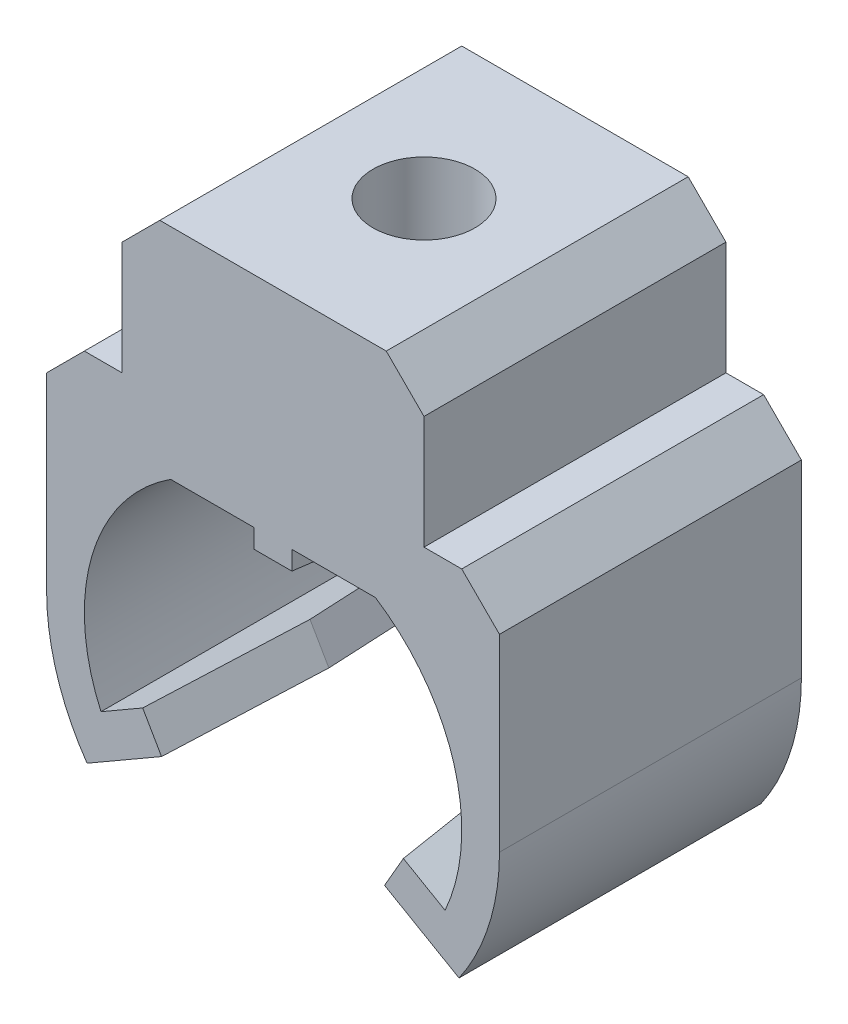
from build123d import *
from OCP.BRepFilletAPI import BRepFilletAPI_MakeChamfer

# Parameters (mm, degrees)
BOSS_EXTRUDE2_DEPTH = 8
SKETCH11_R          = 1.35
CUT_EXTRUDE5_DEPTH  = 5
CHAMFER1_SIZE       = 1
CHAMFER2_SIZE       = 4
CHAMFER2_SIZE_2     = 0.5
CHAMFER3_SIZE       = 0.5
CHAMFER3_SIZE2      = 4


with BuildPart() as part:
    # Sketch1 → Boss-Extrude2 (new body)
    with BuildSketch(Plane.XY):
        with BuildLine():
            Line((-2.712931993, 4.2), (-0.5, 4.2))
            Line((-0.5, 4.2), (-0.5, 3.2))
            Line((-0.5, 3.2), (0.5, 3.2))
            Line((0.5, 3.2), (0.5, 4.2))
            Line((0.5, 4.2), (2.712931993, 4.2))
            ThreePointArc((2.712931993, 4.2), (4.795591913, 1.415025868), (4.558421985, -2.054455891))
            Line((4.558421985, -2.054455891), (3.021281292, -1.166987298))
            Line((3.021281292, -1.166987298), (2.521281292, -2.033012702))
            Line((2.521281292, -2.033012702), (4.928078794, -3.422577888))
            ThreePointArc((4.928078794, -3.422577888), (5.725752036, -1.793255034), (6, 0))
            Line((6, 0), (6, 6))
            Line((6, 6), (4, 6))
            Line((4, 6), (4, 10))
            Line((4, 10), (-4, 10))
            Line((-4, 10), (-4, 6))
            Line((-4, 6), (-6, 6))
            Line((-6, 6), (-6, 0))
            ThreePointArc((-6, 0), (-5.725752036, -1.793255034), (-4.928078794, -3.422577888))
            Line((-4.928078794, -3.422577888), (-2.521281292, -2.033012702))
            Line((-2.521281292, -2.033012702), (-3.021281292, -1.166987298))
            Line((-3.021281292, -1.166987298), (-4.558421985, -2.054455891))
            ThreePointArc((-4.558421985, -2.054455891), (-4.795591913, 1.415025868), (-2.712931993, 4.2))
        make_face()
    extrude(amount=BOSS_EXTRUDE2_DEPTH)

    # Sketch11 → Cut-Extrude5 (cut)
    with BuildSketch(Plane(origin=(0, 10, 0), x_dir=(1, 0, 0), z_dir=(0, 1, 0))):
        with Locations(Location((0, -4, 0), (0, 0, 270))):
            Circle(SKETCH11_R)
    extrude(amount=-CUT_EXTRUDE5_DEPTH, mode=Mode.SUBTRACT)

    # Chamfer1
    chamfer1_edges = [part.edges().sort_by_distance(p)[0] for p in [
        (-6, 6, 4),
        (-4, 10, 4),
        (4, 10, 4),
        (6, 6, 4),
    ]]
    chamfer(chamfer1_edges, length=CHAMFER1_SIZE)

    # Chamfer2
    chamfer2_edges_1 = [part.edges().sort_by_distance(p)[0] for p in [
        (2.771281292, -1.6, 8),
    ]]
    chamfer2_side_1 = [part.faces().sort_by_distance(p)[0] for p in [
        (2.771281292, -1.6, 7.99),
    ]]
    chamfer2_edges_2 = [part.edges().sort_by_distance(p)[0] for p in [
        (2.771281292, -1.6, 0),
    ]]
    chamfer2_side_2 = [part.faces().sort_by_distance(p)[0] for p in [
        (2.779941546, -1.605, 0),
    ]]
    chamfer2_edges_3 = [part.edges().sort_by_distance(p)[0] for p in [
        (0, 3.2, 8),
    ]]
    chamfer2_side_3 = [part.faces().sort_by_distance(p)[0] for p in [
        (0, 3.2, 7.99),
    ]]
    chamfer2_edges_4 = [part.edges().sort_by_distance(p)[0] for p in [
        (-2.771281292, -1.6, 8),
    ]]
    chamfer2_side_4 = [part.faces().sort_by_distance(p)[0] for p in [
        (-2.771281292, -1.6, 7.99),
    ]]
    chamfer2 = BRepFilletAPI_MakeChamfer(part.part.solid().wrapped)
    for e in chamfer2_edges_1:
        chamfer2.Add(CHAMFER2_SIZE - 0.0001, CHAMFER2_SIZE_2 - 0.0001, e.wrapped, chamfer2_side_1[0].wrapped)
    for e in chamfer2_edges_2:
        chamfer2.Add(CHAMFER2_SIZE_2 - 0.0001, CHAMFER2_SIZE - 0.0001, e.wrapped, chamfer2_side_2[0].wrapped)
    for e in chamfer2_edges_3:
        chamfer2.Add(CHAMFER2_SIZE - 0.0001, CHAMFER2_SIZE_2 - 0.0001, e.wrapped, chamfer2_side_3[0].wrapped)
    for e in chamfer2_edges_4:
        chamfer2.Add(CHAMFER2_SIZE - 0.0001, CHAMFER2_SIZE_2 - 0.0001, e.wrapped, chamfer2_side_4[0].wrapped)
    add(Compound.cast(chamfer2.Shape()), mode=Mode.REPLACE)  # a hair under: the kernel refuses the full size

    # Chamfer3
    chamfer3_edges = [part.edges().sort_by_distance(p)[0] for p in [
        (-2.771281292, -1.6, 0),
        (0, 3.2, 0),
    ]]
    chamfer3_side = [part.faces().sort_by_distance(p)[0] for p in [
        (-0.019519244, 4.871717055, 0),
    ]]
    chamfer(chamfer3_edges, length=CHAMFER3_SIZE, length2=CHAMFER3_SIZE2, reference=chamfer3_side[0])


solid = part.part
